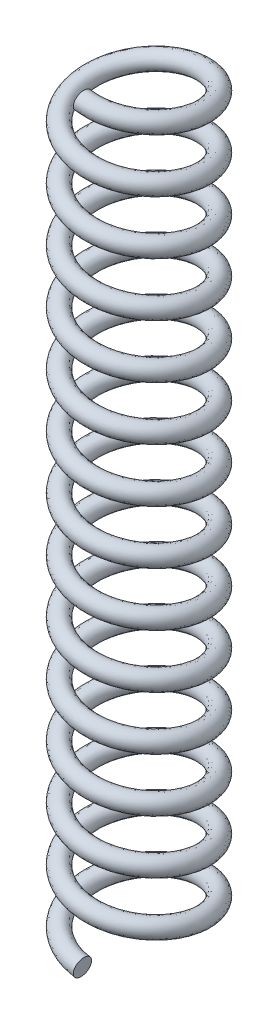
from build123d import *

# Parameters (mm, degrees)
COIL_WIRE_PITCH     = 2.371422438
COIL_WIRE_HEIGHT    = 33.199914139
COIL_WIRE_RADIUS    = 2.5
COIL_WIRE_PROFILE_R = 0.4


with BuildPart() as part:
    # Coil_Wire: sweep along a helix
    with BuildLine() as coil_wire_path:
        Helix(COIL_WIRE_PITCH, COIL_WIRE_HEIGHT, COIL_WIRE_RADIUS, center=(0, 0, 0), direction=(0, 1, 0), lefthand=True)
    # Coil_Wire profile (on start of the path) → Coil_Wire (sweep)
    with BuildSketch(Plane(origin=(0, 0, 2.5), x_dir=(-0.14927787183737004, -0.9887952856783379, 0), z_dir=(-0.9887952856783379, 0.14927787183737004, 8.346518209376106e-14))):
        Circle(COIL_WIRE_PROFILE_R)
    sweep(path=coil_wire_path.line, is_frenet=True)


solid = part.part
